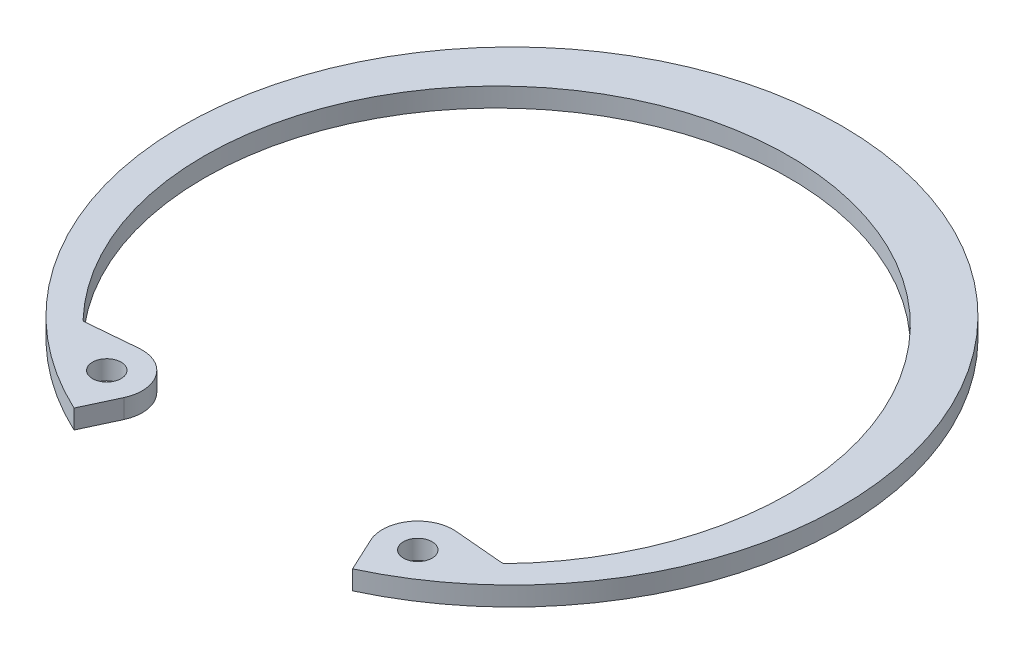
from build123d import *

# Parameters (mm, degrees)
SKETCH2_R      = 1.1811
EXTRUDE1_DEPTH = 1.5748
FILLET1_R      = 0.254


with BuildPart() as part:
    # Sketch2 → Extrude1 (new body)
    with BuildSketch(Plane(origin=(0, 0, 0), x_dir=(1, 0, 0), z_dir=(0, 1, 0))):
        with BuildLine():
            Line((11.49128637, -24.643143145), (10.182259727, -21.83592645))
            ThreePointArc((10.182259727, -21.83592645), (10.436841651, -18.926041737), (13.084166697, -17.691573795))
            Line((13.084166697, -17.691573795), (17.32957252, -18.062998676))
            ThreePointArc((17.32957252, -18.062998676), (0, 22.8727), (-17.32957252, -18.062998676))
            Line((-17.32957252, -18.062998676), (-13.084166697, -17.691573795))
            ThreePointArc((-13.084166697, -17.691573795), (-10.436841651, -18.926041737), (-10.182259727, -21.83592645))
            Line((-10.182259727, -21.83592645), (-11.49128637, -24.643143145))
            ThreePointArc((-11.49128637, -24.643143145), (0, 27.1907), (11.49128637, -24.643143145))
        make_face()
        with Locations((12.829584773, -20.601458508)):
            Circle(SKETCH2_R, mode=Mode.SUBTRACT)
        with Locations((-12.829584773, -20.601458508)):
            Circle(SKETCH2_R, mode=Mode.SUBTRACT)
    extrude(amount=-EXTRUDE1_DEPTH)

    # Fillet1
    fillet1_edges = [part.edges().sort_by_distance(p)[0] for p in [
        (-17.32957252, -0.7874, 18.062998676),
        (17.32957252, -0.7874, 18.062998676),
    ]]
    fillet(fillet1_edges, radius=FILLET1_R)


solid = part.part
